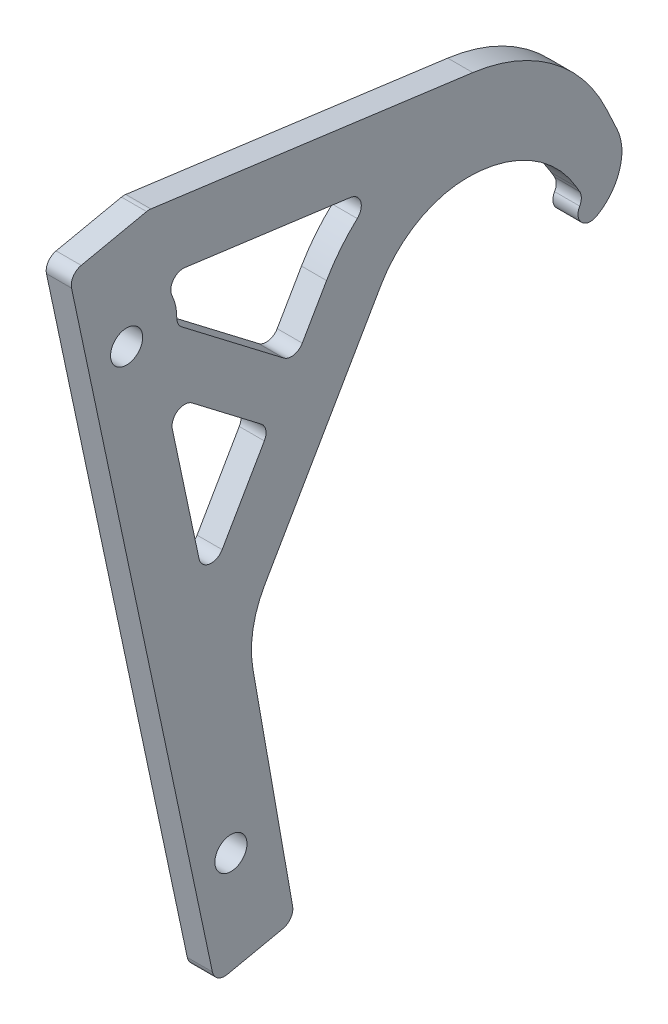
from build123d import *

# Parameters (mm, degrees)
BOSS_EXTRUDE1_DEPTH = 3.175
FILLET1_R           = 12.7
FILLET2_R           = 1.5875
FILLET3_R           = 1.5875
SKETCH2_R           = 2.032
CUT_EXTRUDE1_DEPTH  = 69.535995798
FILLET4_R           = 1.5875


with BuildPart() as part:
    # Sketch1 → Boss-Extrude1 (new body)
    with BuildSketch(Plane(origin=(0, 0, 0), x_dir=(0, 0, -1), z_dir=(1, 0, 0))):
        with BuildLine():
            Line((13.748153285, 22.0345), (14.739116884, 20.318100699))
            ThreePointArc((14.739116884, 20.318100699), (14.158051555, 18.149535371), (16.326616884, 17.568470042))
            ThreePointArc((16.326616884, 17.568470042), (19.207719521, 21.158249529), (18.906671331, 25.751357318))
            Line((18.906671331, 25.751357318), (17.516713222, 28.732132102))
            ThreePointArc((17.516713222, 28.732132102), (10.661882173, 37.091365139), (0.634495892, 41.130797035))
            Line((0.634495892, 41.130797035), (-40.382266976, 46.59538876))
            Line((-40.382266976, 46.59538876), (-50.475527532, 44.45))
            Line((-50.475527532, 44.45), (-31.992178218, -42.507321705))
            Line((-31.992178218, -42.507321705), (-21.898917663, -40.361932946))
            Line((-21.898917663, -40.361932946), (-27.991294866, -5.810344877))
            Line((-27.991294866, -5.810344877), (-10.998522628, 23.622))
            ThreePointArc((-10.998522628, 23.622), (-6.35, 28.270522628), (0, 29.972))
            ThreePointArc((0, 29.972), (7.9375, 27.845153285), (13.748153285, 22.0345))
        make_face()
    extrude(amount=BOSS_EXTRUDE1_DEPTH)

    # Fillet1
    fillet1_edges = [part.edges().sort_by_distance(p)[0] for p in [
        (1.5875, -5.810344877, 27.991294866),
    ]]
    fillet(fillet1_edges, radius=FILLET1_R)

    # Fillet2
    fillet2_edges = [part.edges().sort_by_distance(p)[0] for p in [
        (1.5875, -40.361932946, 21.898917663),
        (1.5875, -42.507321705, 31.992178218),
        (1.5875, 44.45, 50.475527532),
        (1.5875, 46.59538876, 40.382266976),
    ]]
    fillet(fillet2_edges, radius=FILLET2_R)

    # Fillet3
    fillet3_edges = [part.edges().sort_by_distance(p)[0] for p in [
        (1.5875, 20.318100699, -14.739116884),
    ]]
    fillet(fillet3_edges, radius=FILLET3_R)

    # Sketch2 → Cut-Extrude1 (cut, through all)
    with BuildSketch(Plane(origin=(3.175, 0, 0), x_dir=(0, 0, -1), z_dir=(1, 0, 0))):
        with Locations((-43.17662111, 33.017704898)):
            Circle(SKETCH2_R)
        with Locations((-29.974228743, -29.094667748)):
            Circle(SKETCH2_R)
        with BuildLine():
            Line((-21.848305026, 20.704625636), (-17.872599271, 27.59075))
            ThreePointArc((-17.872599271, 27.59075), (-14.903788227, 31.547275925), (-11.078768079, 34.683700207))
            Line((-11.078768079, 34.683700207), (-40.047392283, 38.543139447))
            ThreePointArc((-40.047392283, 38.543139447), (-37.495523437, 35.854539267), (-36.879589172, 32.199237568))
            Line((-36.879589172, 32.199237568), (-21.848305026, 20.704625636))
        make_face()
        with BuildLine():
            Line((-38.286199293, 25.280985715), (-25.05001183, 15.159106781))
            Line((-25.05001183, 15.159106781), (-32.554160521, 2.161539981))
            ThreePointArc((-32.554160521, 2.161539981), (-32.855452365, 1.621137898), (-33.140409238, 1.071946887))
            Line((-33.140409238, 1.071946887), (-38.286199293, 25.280985715))
        make_face()
    extrude(amount=-CUT_EXTRUDE1_DEPTH, mode=Mode.SUBTRACT)

    # Fillet4
    fillet4_edges = [part.edges().sort_by_distance(p)[0] for p in [
        (1.5875, 20.704625636, 21.848305026),
        (1.5875, 34.683700207, 11.078768079),
        (1.5875, 38.543139447, 40.047392283),
        (1.5875, 32.199237568, 36.879589172),
        (1.5875, 25.280985715, 38.286199293),
        (1.5875, 1.071946887, 33.140409238),
        (1.5875, 15.159106781, 25.05001183),
    ]]
    fillet(fillet4_edges, radius=FILLET4_R - 0.0001)  # a hair under: the kernel refuses the full size


solid = part.part
